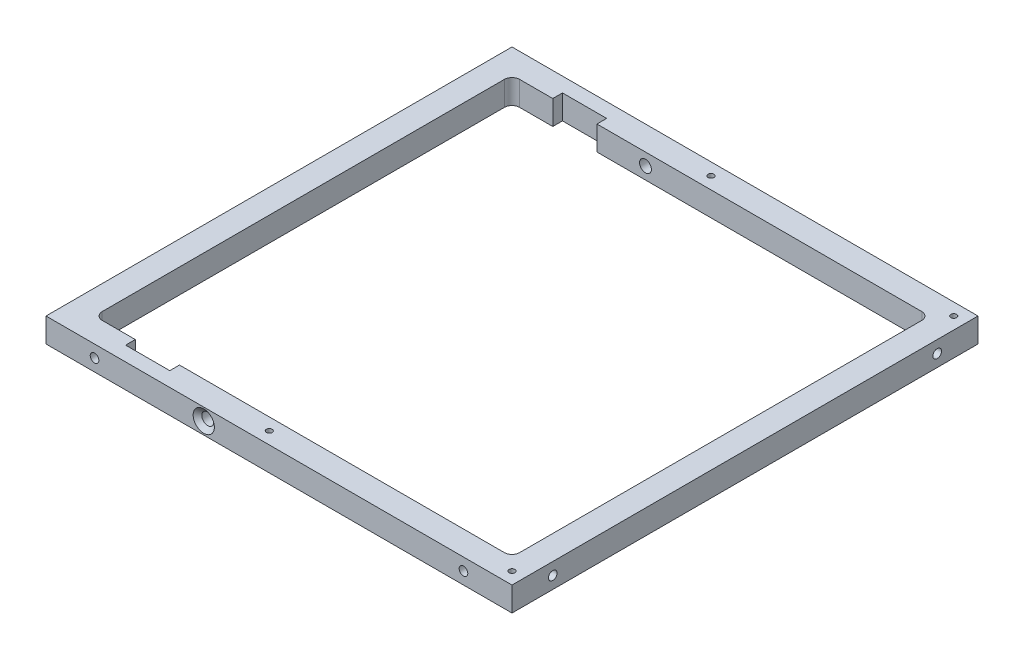
from build123d import *

# Parameters (mm, degrees)
SKETCH1_W                                         = 96
SKETCH1_H                                         = 96
BOSS_EXTRUDE1_DEPTH                               = 5
CUT_EXTRUDE10_DEPTH                               = 92
CUT_EXTRUDE10_DEPTH_BACK                          = 6
SKETCH47_R                                        = 0.8255
SKETCH39_R                                        = 0.889
CUT_EXTRUDE4_DEPTH                                = 3
SKETCH40_R                                        = 0.889
CUT_EXTRUDE5_DEPTH                                = 3
SKETCH41_R                                        = 0.889
CUT_EXTRUDE6_DEPTH                                = 3
CUT_EXTRUDE7_START                                = -3
SKETCH42_R                                        = 0.889
CUT_EXTRUDE7_DEPTH                                = 3
CUT_EXTRUDE8_START                                = -3
SKETCH43_R                                        = 0.889
CUT_EXTRUDE8_DEPTH                                = 3
CSK_FOR_2_FLAT_HEAD_MACHINE_SCREW_100_D           = 2.4384
CSK_FOR_2_FLAT_HEAD_MACHINE_SCREW_100_DEPTH       = 32
CSK_FOR_2_FLAT_HEAD_MACHINE_SCREW_100_CSINK_D     = 4.3688
CSK_FOR_2_FLAT_HEAD_MACHINE_SCREW_100_CSINK_ANGLE = 100
CSK_FOR_2_FLAT_HEAD_MACHINE_SCREW_100_TIP         = 0.732569267
CSK_FOR_2_FLAT_HEAD_MACHINE_SCREW_2_D             = 2.4384
CSK_FOR_2_FLAT_HEAD_MACHINE_SCREW_2_DEPTH         = 32
CSK_FOR_2_FLAT_HEAD_MACHINE_SCREW_2_CSINK_D       = 4.3688
CSK_FOR_2_FLAT_HEAD_MACHINE_SCREW_2_CSINK_ANGLE   = 100
CSK_FOR_2_FLAT_HEAD_MACHINE_SCREW_2_TIP           = 0.732569267
TAP_DRILL_FOR_0_80_TAP6_D                         = 1.19126
TAP_DRILL_FOR_0_80_TAP6_DEPTH                     = 3
TAP_DRILL_FOR_0_80_TAP6_TIP                       = 0.357890611


with BuildPart() as part:
    # Sketch1 → Boss-Extrude1 (new body)
    with BuildSketch(Plane(origin=(0, 0, 0), x_dir=(1, 0, 0), z_dir=(0, 1, 0))):
        Rectangle(SKETCH1_W, SKETCH1_H)
        with BuildLine():
            Line((-13, -43), (41.4125, -43))
            ThreePointArc((41.4125, -43), (42.535032015, -42.535032015), (43, -41.4125))
            Line((43, -41.4125), (43, 41.4125))
            ThreePointArc((43, 41.4125), (42.535032015, 42.535032015), (41.4125, 43))
            Line((41.4125, 43), (-13, 43))
            Line((-13, 43), (-18, 43))
            Line((-18, 43), (-25.5, 43))
            Line((-25.5, 43), (-25.5, 45))
            Line((-25.5, 45), (-34.6, 45))
            Line((-34.6, 45), (-34.6, 43))
            Line((-34.6, 43), (-41.4125, 43))
            ThreePointArc((-41.4125, 43), (-42.535032015, 42.535032015), (-43, 41.4125))
            Line((-43, 41.4125), (-43, -41.4125))
            ThreePointArc((-43, -41.4125), (-42.535032015, -42.535032015), (-41.4125, -43))
            Line((-41.4125, -43), (-34.6, -43))
            Line((-34.6, -43), (-34.6, -45))
            Line((-34.6, -45), (-25.5, -45))
            Line((-25.5, -45), (-25.5, -43))
            Line((-25.5, -43), (-18, -43))
            Line((-18, -43), (-13, -43))
        make_face(mode=Mode.SUBTRACT)
    extrude(amount=BOSS_EXTRUDE1_DEPTH)

    # Sketch47 → Cut-Extrude10 (cut, two sides: drawn at the far end of the back side and taken through both)
    with BuildSketch(Plane.XY.offset(-43).offset(-CUT_EXTRUDE10_DEPTH_BACK)):
        with Locations((-15.5, 2.5)):
            Circle(SKETCH47_R)
    extrude(amount=CUT_EXTRUDE10_DEPTH + CUT_EXTRUDE10_DEPTH_BACK, mode=Mode.SUBTRACT)

    # Sketch39 → Cut-Extrude4 (cut)
    with BuildSketch(Plane.XZ):
        with Locations((-45.5, -30)):
            Circle(SKETCH39_R)
        with Locations((-45.5, 30)):
            Circle(SKETCH39_R)
        with Locations((45.5, 30)):
            Circle(SKETCH39_R)
        with Locations((45.5, -30)):
            Circle(SKETCH39_R)
    extrude(amount=-CUT_EXTRUDE4_DEPTH, mode=Mode.SUBTRACT)

    # Sketch40 → Cut-Extrude5 (cut)
    with BuildSketch(Plane.ZY.offset(48)):
        with Locations((-39.6002, 2.5)):
            Circle(SKETCH40_R)
        with Locations((39.6002, 2.5)):
            Circle(SKETCH40_R)
    extrude(amount=-CUT_EXTRUDE5_DEPTH, mode=Mode.SUBTRACT)

    # Sketch41 → Cut-Extrude6 (cut)
    with BuildSketch(Plane(origin=(0, 0, -48), x_dir=(-1, 0, 0), z_dir=(0, 0, -1))):
        with Locations((38, 2.5)):
            Circle(SKETCH41_R)
        with Locations((-38, 2.5)):
            Circle(SKETCH41_R)
    extrude(amount=-CUT_EXTRUDE6_DEPTH, mode=Mode.SUBTRACT)

    # Sketch42 → Cut-Extrude7 (cut)
    with BuildSketch(Plane(origin=(48, 0, 0), x_dir=(0, 0, -1), z_dir=(1, 0, 0)).offset(CUT_EXTRUDE7_START)):
        with Locations((39.6002, 2.5)):
            Circle(SKETCH42_R)
        with Locations((-39.6002, 2.5)):
            Circle(SKETCH42_R)
    extrude(amount=CUT_EXTRUDE7_DEPTH, mode=Mode.SUBTRACT)

    # Sketch43 → Cut-Extrude8 (cut)
    with BuildSketch(Plane.XY.offset(48).offset(CUT_EXTRUDE8_START)):
        with Locations((38, 2.5)):
            Circle(SKETCH43_R)
        with Locations((-38, 2.5)):
            Circle(SKETCH43_R)
    extrude(amount=CUT_EXTRUDE8_DEPTH, mode=Mode.SUBTRACT)

    # CSK for _2 Flat Head Machine Screw _100
    with Locations(Plane.XY.offset(48)):
        with Locations((-15.5, 2.5)):
            CounterSinkHole(CSK_FOR_2_FLAT_HEAD_MACHINE_SCREW_100_D / 2, CSK_FOR_2_FLAT_HEAD_MACHINE_SCREW_100_CSINK_D / 2, depth=CSK_FOR_2_FLAT_HEAD_MACHINE_SCREW_100_DEPTH, counter_sink_angle=CSK_FOR_2_FLAT_HEAD_MACHINE_SCREW_100_CSINK_ANGLE)
            with Locations((0, 0, -(CSK_FOR_2_FLAT_HEAD_MACHINE_SCREW_100_DEPTH + CSK_FOR_2_FLAT_HEAD_MACHINE_SCREW_100_TIP / 2))):  # 118° drill point
                Cone(0, CSK_FOR_2_FLAT_HEAD_MACHINE_SCREW_100_D / 2, CSK_FOR_2_FLAT_HEAD_MACHINE_SCREW_100_TIP, mode=Mode.SUBTRACT)

    # CSK for _2 Flat Head Machine Screw _ 2
    with Locations(Plane(origin=(0, 0, -48), x_dir=(-1, 0, 0), z_dir=(0, 0, -1))):
        with Locations((15.5, 2.5)):
            CounterSinkHole(CSK_FOR_2_FLAT_HEAD_MACHINE_SCREW_2_D / 2, CSK_FOR_2_FLAT_HEAD_MACHINE_SCREW_2_CSINK_D / 2, depth=CSK_FOR_2_FLAT_HEAD_MACHINE_SCREW_2_DEPTH, counter_sink_angle=CSK_FOR_2_FLAT_HEAD_MACHINE_SCREW_2_CSINK_ANGLE)
            with Locations((0, 0, -(CSK_FOR_2_FLAT_HEAD_MACHINE_SCREW_2_DEPTH + CSK_FOR_2_FLAT_HEAD_MACHINE_SCREW_2_TIP / 2))):  # 118° drill point
                Cone(0, CSK_FOR_2_FLAT_HEAD_MACHINE_SCREW_2_D / 2, CSK_FOR_2_FLAT_HEAD_MACHINE_SCREW_2_TIP, mode=Mode.SUBTRACT)

    # Tap Drill for #0-80 Tap6
    with Locations(Plane(origin=(0, 5, 0), x_dir=(1, 0, 0), z_dir=(0, 1, 0))):
        with Locations((-4.5, -45.5), (45.5, -45.5), (45.5, 45.5), (-4.5, 45.5)):
            Hole(TAP_DRILL_FOR_0_80_TAP6_D / 2, depth=TAP_DRILL_FOR_0_80_TAP6_DEPTH)
            with Locations((0, 0, -(TAP_DRILL_FOR_0_80_TAP6_DEPTH + TAP_DRILL_FOR_0_80_TAP6_TIP / 2))):  # 118° drill point
                Cone(0, TAP_DRILL_FOR_0_80_TAP6_D / 2, TAP_DRILL_FOR_0_80_TAP6_TIP, mode=Mode.SUBTRACT)


solid = part.part
